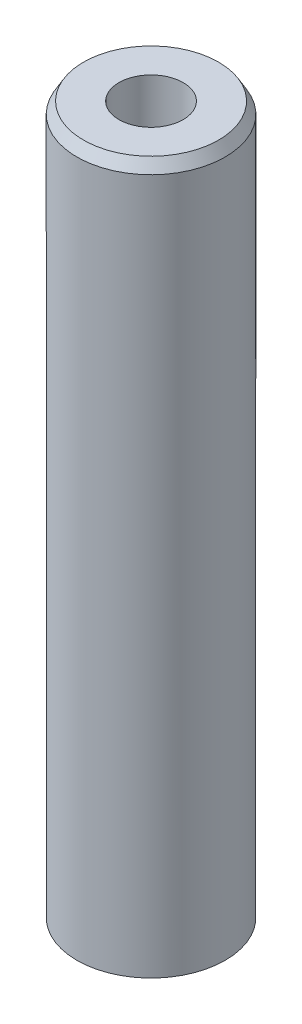
from build123d import *
from OCP.BRepFilletAPI import BRepFilletAPI_MakeChamfer

# Parameters (mm, degrees)
SKETCH1_R           = 5
BOSS_EXTRUDE1_DEPTH = 48.134571879
SKETCH2_R           = 2.166215189
CUT_EXTRUDE1_DEPTH  = 49.651176861
CHAMFER1_SIZE       = 0.767651365
CHAMFER1_SIZE2      = 0.443203722


with BuildPart() as part:
    # Sketch1 → Boss-Extrude1 (new body)
    with BuildSketch(Plane(origin=(0, 0, 0), x_dir=(1, 0, 0), z_dir=(0, 1, 0))):
        Circle(SKETCH1_R)
    extrude(amount=BOSS_EXTRUDE1_DEPTH)

    # Sketch2 → Cut-Extrude1 (cut, through all)
    with BuildSketch(Plane(origin=(0, 0, 0), x_dir=(1, 0, 0), z_dir=(0, 1, 0))):
        Circle(SKETCH2_R)
    extrude(amount=CUT_EXTRUDE1_DEPTH, mode=Mode.SUBTRACT)

    # Chamfer1: one chamfer whose edges measure the first distance from different faces: ONE call of the kernel's chamfer builder (chamfer() names one face for all edges)
    chamfer1_edges_1 = [part.edges().sort_by_distance(p)[0] for p in [
        (-5, 48.134571879, 0),
    ]]
    chamfer1_side_1 = [part.faces().sort_by_distance(p)[0] for p in [
        (-5, 24.067285939, 0),
    ]]
    chamfer1_edges_2 = [part.edges().sort_by_distance(p)[0] for p in [
        (-5, 0, 0),
    ]]
    chamfer1_side_2 = [part.faces().sort_by_distance(p)[0] for p in [
        (-4.858578644, 0, 0),
    ]]
    chamfer1 = BRepFilletAPI_MakeChamfer(part.part.solid().wrapped)
    for e in chamfer1_edges_1:
        chamfer1.Add(CHAMFER1_SIZE, CHAMFER1_SIZE2, e.wrapped, chamfer1_side_1[0].wrapped)  # the first distance lies on this face
    for e in chamfer1_edges_2:
        chamfer1.Add(CHAMFER1_SIZE, CHAMFER1_SIZE2, e.wrapped, chamfer1_side_2[0].wrapped)  # the first distance lies on this face
    add(Compound.cast(chamfer1.Shape()), mode=Mode.REPLACE)


solid = part.part
